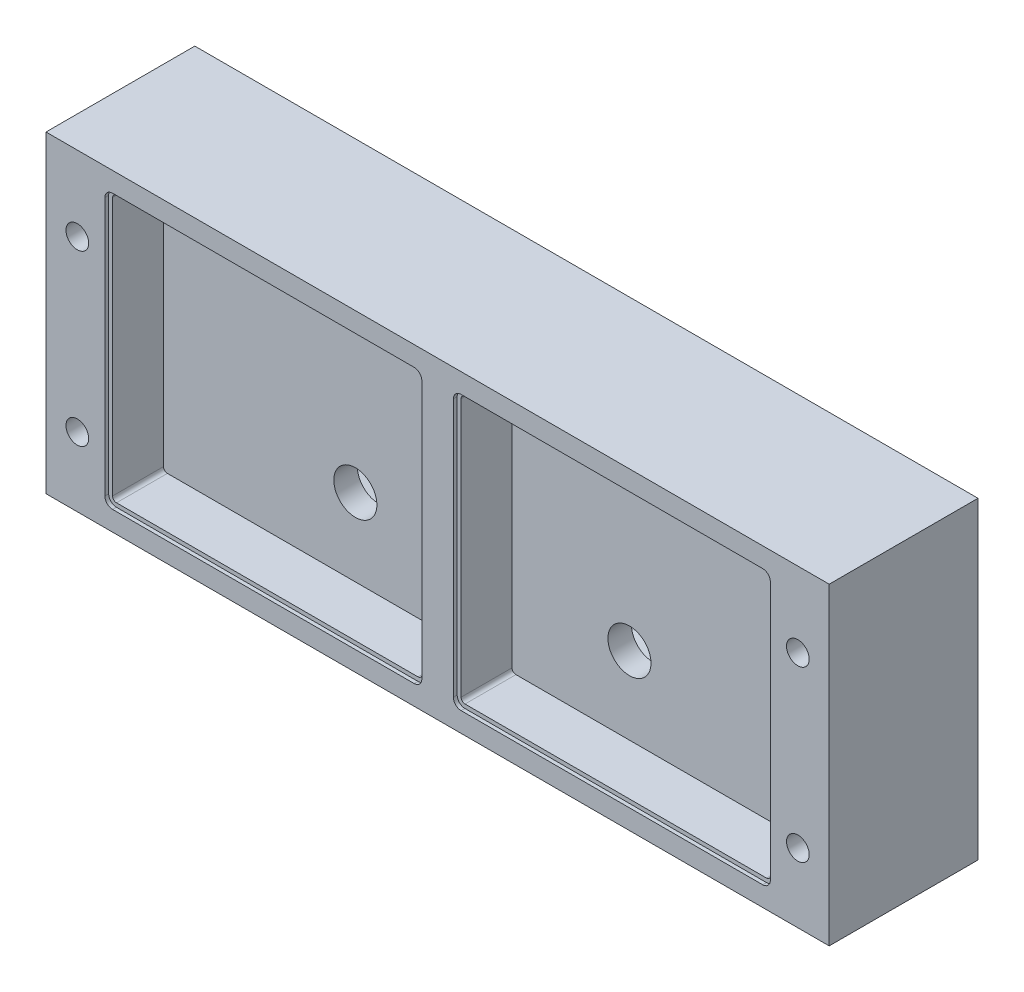
from build123d import *

# Parameters (mm, degrees)
SKETCH1_W           = 100
SKETCH1_H           = 40
BOSS_EXTRUDE1_DEPTH = 38
CUT_EXTRUDE2_START  = -12
SKETCH2_W           = 39.5
SKETCH2_H           = 34
CUT_EXTRUDE2_DEPTH  = 21
CUT_EXTRUDE4_REACH  = 81.36
SKETCH4_R           = 1.45
SKETCH6_W           = 100
SKETCH6_H           = 19
CUT_EXTRUDE5_DEPTH  = 87.215210375
FILLET1_R           = 0.5
CUT_EXTRUDE6_START  = 6.5
CUT_EXTRUDE6_DEPTH  = 0.5
CUT_EXTRUDE6_TAPER  = 2
CUT_EXTRUDE7_START  = 6.5
CUT_EXTRUDE7_DEPTH  = 0.5
CUT_EXTRUDE7_TAPER  = 2
CUT_EXTRUDE8_DEPTH  = 9
CUT_EXTRUDE9_REACH  = 72.385
SKETCH14_R          = 2.75
BOSS_EXTRUDE2_START = 8
BOSS_EXTRUDE2_DEPTH = 1
BOSS_EXTRUDE2_DRAFT = 2
CUT_EXTRUDE11_START = 9
CUT_EXTRUDE11_DEPTH = 1


with BuildPart() as part:
    # Sketch1 → Boss-Extrude1 (new body)
    with BuildSketch(Plane.XY):
        with Locations((16.25, 1.5625)):
            Rectangle(SKETCH1_W, SKETCH1_H)
    extrude(amount=BOSS_EXTRUDE1_DEPTH)

    # Sketch2 → Cut-Extrude2 (cut)
    with BuildSketch(Plane(origin=(0, 0, 0), x_dir=(-1, 0, 0), z_dir=(0, 0, -1)).offset(CUT_EXTRUDE2_START)):
        with Locations((-38.5, 1.5625)):
            Rectangle(SKETCH2_W, SKETCH2_H)
        with Locations((6, 1.5625)):
            Rectangle(SKETCH2_W, SKETCH2_H)
    extrude(amount=-CUT_EXTRUDE2_DEPTH, mode=Mode.SUBTRACT)

    # Sketch4 → Cut-Extrude4 (cut, up to next)
    with BuildSketch(Plane(origin=(0, 0, 0), x_dir=(-1, 0, 0), z_dir=(0, 0, -1)), mode=Mode.PRIVATE) as cut_extrude4_sk1:
        with Locations((-62.25, 11.98479819)):
            Circle(SKETCH4_R)
    cut_extrude4_tool1 = extrude(cut_extrude4_sk1.sketch, amount=-CUT_EXTRUDE4_REACH, mode=Mode.PRIVATE) & part.part
    # Sketch4 → Cut-Extrude4 (cut, up to next)
    with BuildSketch(Plane(origin=(0, 0, 0), x_dir=(-1, 0, 0), z_dir=(0, 0, -1)), mode=Mode.PRIVATE) as cut_extrude4_sk2:
        with Locations((-62.25, -9.616561755)):
            Circle(SKETCH4_R)
    cut_extrude4_tool2 = extrude(cut_extrude4_sk2.sketch, amount=-CUT_EXTRUDE4_REACH, mode=Mode.PRIVATE) & part.part
    # Sketch4 → Cut-Extrude4 (cut, up to next)
    with BuildSketch(Plane(origin=(0, 0, 0), x_dir=(-1, 0, 0), z_dir=(0, 0, -1)), mode=Mode.PRIVATE) as cut_extrude4_sk3:
        with Locations((29.75, 11.98479819)):
            Circle(SKETCH4_R)
    cut_extrude4_tool3 = extrude(cut_extrude4_sk3.sketch, amount=-CUT_EXTRUDE4_REACH, mode=Mode.PRIVATE) & part.part
    # Sketch4 → Cut-Extrude4 (cut, up to next)
    with BuildSketch(Plane(origin=(0, 0, 0), x_dir=(-1, 0, 0), z_dir=(0, 0, -1)), mode=Mode.PRIVATE) as cut_extrude4_sk4:
        with Locations((29.75, -9.616561755)):
            Circle(SKETCH4_R)
    cut_extrude4_tool4 = extrude(cut_extrude4_sk4.sketch, amount=-CUT_EXTRUDE4_REACH, mode=Mode.PRIVATE) & part.part
    add(cut_extrude4_tool1.solids().sort_by_distance((62.25, 11.984798, 0))[0], mode=Mode.SUBTRACT)
    add(cut_extrude4_tool2.solids().sort_by_distance((62.25, -9.616562, 0))[0], mode=Mode.SUBTRACT)
    add(cut_extrude4_tool3.solids().sort_by_distance((-29.75, 11.984798, 0))[0], mode=Mode.SUBTRACT)
    add(cut_extrude4_tool4.solids().sort_by_distance((-29.75, -9.616562, 0))[0], mode=Mode.SUBTRACT)

    # Sketch6 → Cut-Extrude5 (cut, through all)
    with BuildSketch(Plane(origin=(0, 21.5625, 0), x_dir=(1, 0, 0), z_dir=(0, 1, 0))):
        with Locations((16.25, -28.5)):
            Rectangle(SKETCH6_W, SKETCH6_H)
    extrude(amount=-CUT_EXTRUDE5_DEPTH, mode=Mode.SUBTRACT)

    # Fillet1
    fillet1_edges = [part.edges().sort_by_distance(p)[0] for p in [
        (58.25, 18.5625, 15.5),
        (58.25, -15.4375, 15.5),
        (18.75, -15.4375, 15.5),
        (18.75, 18.5625, 15.5),
        (13.75, 18.5625, 15.5),
        (13.75, -15.4375, 15.5),
        (-25.75, -15.4375, 15.5),
        (-25.75, 18.5625, 15.5),
    ]]
    fillet(fillet1_edges, radius=FILLET1_R)

    # Sketch10 → Cut-Extrude6 (cut)
    with BuildSketch(Plane.XY.offset(12).offset(CUT_EXTRUDE6_START)):
        with BuildLine():
            Line((14.25, -14.9375), (14.25, 18.0625))
            ThreePointArc((14.25, 18.0625), (13.957106781, 18.769606781), (13.25, 19.0625))
            Line((13.25, 19.0625), (-25.25, 19.0625))
            ThreePointArc((-25.25, 19.0625), (-25.957106781, 18.769606781), (-26.25, 18.0625))
            Line((-26.25, 18.0625), (-26.25, -14.9375))
            ThreePointArc((-26.25, -14.9375), (-25.957106781, -15.644606781), (-25.25, -15.9375))
            Line((-25.25, -15.9375), (13.25, -15.9375))
            ThreePointArc((13.25, -15.9375), (13.957106781, -15.644606781), (14.25, -14.9375))
        make_face()
    extrude(amount=CUT_EXTRUDE6_DEPTH, taper=CUT_EXTRUDE6_TAPER, mode=Mode.SUBTRACT)

    # Sketch11 → Cut-Extrude7 (cut)
    with BuildSketch(Plane.XY.offset(12).offset(CUT_EXTRUDE7_START)):
        with BuildLine():
            Line((58.75, -14.9375), (58.75, 18.0625))
            ThreePointArc((58.75, 18.0625), (58.457106781, 18.769606781), (57.75, 19.0625))
            Line((57.75, 19.0625), (19.25, 19.0625))
            ThreePointArc((19.25, 19.0625), (18.542893219, 18.769606781), (18.25, 18.0625))
            Line((18.25, 18.0625), (18.25, -14.9375))
            ThreePointArc((18.25, -14.9375), (18.542893219, -15.644606781), (19.25, -15.9375))
            Line((19.25, -15.9375), (57.75, -15.9375))
            ThreePointArc((57.75, -15.9375), (58.457106781, -15.644606781), (58.75, -14.9375))
        make_face()
    extrude(amount=CUT_EXTRUDE7_DEPTH, taper=CUT_EXTRUDE7_TAPER, mode=Mode.SUBTRACT)

    # Sketch12 → Cut-Extrude8 (cut)
    with BuildSketch(Plane(origin=(0, 0, 0), x_dir=(-1, 0, 0), z_dir=(0, 0, -1))):
        with BuildLine():
            ThreePointArc((-57.865926724, 2.836052), (-16.25, -14.444957865), (25.365926724, 2.836052))
            ThreePointArc((25.365926724, 2.836052), (25.351045487, 11.250609537), (16.93648795, 11.235728299))
            ThreePointArc((16.93648795, 11.235728299), (-16.25, -2.544957865), (-49.43648795, 11.235728299))
            ThreePointArc((-49.43648795, 11.235728299), (-57.851045487, 11.250609537), (-57.865926724, 2.836052))
        make_face()
    extrude(amount=-CUT_EXTRUDE8_DEPTH, mode=Mode.SUBTRACT)

    # Sketch14 → Cut-Extrude9 (cut, up to next)
    with BuildSketch(Plane(origin=(0, 0, 9), x_dir=(-1, 0, 0), z_dir=(0, 0, -1)), mode=Mode.PRIVATE) as cut_extrude9_sk1:
        with Locations((-33.75, -5.553059818)):
            Circle(SKETCH14_R)
    cut_extrude9_tool1 = extrude(cut_extrude9_sk1.sketch, amount=-CUT_EXTRUDE9_REACH, mode=Mode.PRIVATE) & part.part
    # Sketch14 → Cut-Extrude9 (cut, up to next)
    with BuildSketch(Plane(origin=(0, 0, 9), x_dir=(-1, 0, 0), z_dir=(0, 0, -1)), mode=Mode.PRIVATE) as cut_extrude9_sk2:
        with Locations((1.25, -5.553059818)):
            Circle(SKETCH14_R)
    cut_extrude9_tool2 = extrude(cut_extrude9_sk2.sketch, amount=-CUT_EXTRUDE9_REACH, mode=Mode.PRIVATE) & part.part
    add(cut_extrude9_tool1.solids().sort_by_distance((33.75, -5.55306, 9))[0], mode=Mode.SUBTRACT)
    add(cut_extrude9_tool2.solids().sort_by_distance((-1.25, -5.55306, 9))[0], mode=Mode.SUBTRACT)


with BuildPart() as body_2:
    # Sketch15 → Boss-Extrude2 (with draft: the straight prism first)
    with BuildSketch(Plane(origin=(0, 0, 9), x_dir=(-1, 0, 0), z_dir=(0, 0, -1)).offset(BOSS_EXTRUDE2_START)):
        with BuildLine():
            ThreePointArc((-49.43648795, 11.235728299), (-57.851045487, 11.250609537), (-57.865926724, 2.836052))
            ThreePointArc((-57.865926724, 2.836052), (-16.25, -14.444957865), (25.365926724, 2.836052))
            ThreePointArc((25.365926724, 2.836052), (25.351045487, 11.250609537), (16.93648795, 11.235728299))
            ThreePointArc((16.93648795, 11.235728299), (-16.25, -2.544957865), (-49.43648795, 11.235728299))
        make_face()
        with BuildLine():
            ThreePointArc((-50.144844149, 10.529873148), (-57.145190336, 10.542253337), (-57.157570525, 3.541907151))
            ThreePointArc((-57.157570525, 3.541907151), (-16.25, -13.444957865), (24.657570525, 3.541907151))
            ThreePointArc((24.657570525, 3.541907151), (24.645190336, 10.542253337), (17.644844149, 10.529873148))
            ThreePointArc((17.644844149, 10.529873148), (-16.25, -3.544957865), (-50.144844149, 10.529873148))
        make_face(mode=Mode.SUBTRACT)
    extrude(amount=BOSS_EXTRUDE2_DEPTH)
    # Boss-Extrude2: the draft: its side faces are tilted about the plane it starts from
    boss_extrude2_sides = [body_2.faces().sort_by_distance(p)[0] for p in [
        (-25.351045487, 11.250609537, 0.5),
        (16.25, -2.544957865, 0.5),
        (57.851045487, 11.250609537, 0.5),
        (16.25, -14.444957865, 0.5),
        (16.25, -13.444957865, 0.5),
        (57.145190336, 10.542253337, 0.5),
        (16.25, -3.544957865, 0.5),
        (-24.645190336, 10.542253337, 0.5),
    ]]
    draft(boss_extrude2_sides, Plane(origin=(0, 0, 9), x_dir=(-1, 0, 0), z_dir=(0, 0, -1)).offset(BOSS_EXTRUDE2_START), BOSS_EXTRUDE2_DRAFT)

    # Sketch16 → Cut-Extrude11 (cut)
    with BuildSketch(Plane(origin=(0, 0, 9), x_dir=(-1, 0, 0), z_dir=(0, 0, -1)).offset(CUT_EXTRUDE11_START)):
        with BuildLine():
            Line((-29.154329219, -0.73272854), (-29.429768477, -1.694047018))
            ThreePointArc((-29.429768477, -1.694047018), (-16.25, -3.544957865), (-3.070231523, -1.694047018))
            Line((-3.070231523, -1.694047018), (-3.345670781, -0.73272854))
            ThreePointArc((-3.345670781, -0.73272854), (-16.25, -2.544957865), (-29.154329219, -0.73272854))
        make_face()
        with BuildLine():
            Line((1.427332066, -10.672902816), (1.733433054, -11.624901863))
            ThreePointArc((1.733433054, -11.624901863), (-16.25, -14.444957865), (-34.233433054, -11.624901863))
            Line((-34.233433054, -11.624901863), (-33.927332066, -10.672902816))
            ThreePointArc((-33.927332066, -10.672902816), (-16.25, -13.444957865), (1.427332066, -10.672902816))
        make_face()
    extrude(amount=-CUT_EXTRUDE11_DEPTH, mode=Mode.SUBTRACT)


with BuildPart() as cut_extrude11_piece_1:
    # of the separate pieces the step leaves, piece 1, a body of its own (cut_extrude11_pieces)
    add(body_2.part.solids().sort_by_distance((57.865926724, 2.836052, 1))[0])


with BuildPart() as cut_extrude11_piece_2:
    # of the separate pieces the step leaves, piece 2, a body of its own (cut_extrude11_pieces)
    add(body_2.part.solids().sort_by_distance((-25.365926724, 2.836052, 1))[0])


solid = Compound([part.part, cut_extrude11_piece_1.part, cut_extrude11_piece_2.part])
